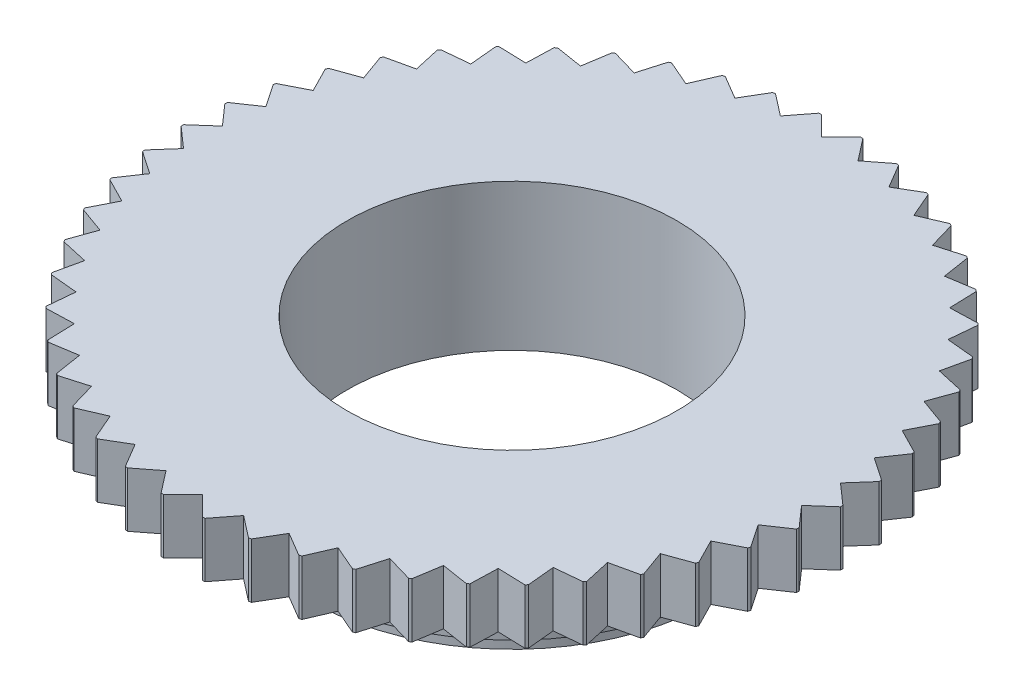
from build123d import *
from build123d.topology import SkipClean

# Parameters (mm, degrees)
SKETCH1_R           = 18
SKETCH1_R_2         = 9
BOSS_EXTRUDE1_DEPTH = 3
BOSS_EXTRUDE2_START = 5
SKETCH2_R           = 11.8
SKETCH2_R_2         = 9
BOSS_EXTRUDE2_DEPTH = 5
THREAD1_PITCH       = 1.5
SKETCH5_R           = 11.8
SKETCH5_R_2         = 11
CUT_EXTRUDE1_DEPTH  = 1
CUT_EXTRUDE3_START  = -3
CUT_EXTRUDE3_DEPTH  = 3


with BuildPart() as part:
    # Sketch1 → Boss-Extrude1 (new body)
    with BuildSketch(Plane(origin=(0, 0, 0), x_dir=(1, 0, 0), z_dir=(0, 1, 0))):
        with Locations(Location((0, 0, 0), (0, 0, 270))):
            Circle(SKETCH1_R)
        with Locations(Location((0, 0, 0), (0, 0, 270))):
            Circle(SKETCH1_R_2, mode=Mode.SUBTRACT)
    extrude(amount=BOSS_EXTRUDE1_DEPTH)

    # Sketch2 → Boss-Extrude2 (add)
    with SkipClean():  # the faces are left unmerged after this step: merging them gives an invalid solid
        with BuildSketch(Plane.XZ.offset(BOSS_EXTRUDE2_START)):
            with Locations(Location((0, 0, 0), (0, 0, 90))):
                Circle(SKETCH2_R)
            with Locations(Location((0, 0, 0), (0, 0, 270))):
                Circle(SKETCH2_R_2, mode=Mode.SUBTRACT)
        extrude(amount=-BOSS_EXTRUDE2_DEPTH)

    # Thread1: the profile of Thread Profile1 profile screwed along a right-hand helix of 1 turns, 8 arcs to a turn; built about Z, then put on its axis
    with SkipClean():  # the faces are left unmerged after this step: merging them gives an invalid solid
        thread1_z = Axis((0, 0, 0), (0, 0, 1))
        thread1_corners = [(11.7997, 0, -0.000173205), (11.7997, 0, 1.312673201), (12.611898813, 0, 0.843749998), (12.611898813, 0, 0.468749998)]
        with BuildLine(mode=Mode.PRIVATE) as thread1_profile:
            Line(thread1_corners[0], thread1_corners[1])
            Line(thread1_corners[1], thread1_corners[2])
            Line(thread1_corners[2], thread1_corners[3])
            Line(thread1_corners[3], thread1_corners[0])
        thread1_cap = Face(thread1_profile.wire())
        thread1_turn_angles = [0, 22.5, 45, 67.5, 90, 112.5, 135, 157.5, 180, 202.5, 225, 247.5, 270, 292.5, 315, 337.5, 360]
        thread1_turn_weights = [1, 0.9238795325112867, 1, 0.9238795325112867, 1, 0.9238795325112867, 1, 0.9238795325112867, 1, 0.9238795325112867, 1, 0.9238795325112867, 1, 0.9238795325112867, 1, 0.9238795325112867, 1]
        thread1_turn_rails = [Edge.make_bspline([Vector(p[0], p[1], 0).rotate(thread1_z, thread1_turn_angles[k]) / thread1_turn_weights[k] + Vector(0, 0, p[2] + THREAD1_PITCH * thread1_turn_angles[k] / 360) for k in range(17)], [0, 0, 0, 1, 1, 2, 2, 3, 3, 4, 4, 5, 5, 6, 6, 7, 7, 8, 8, 8], 2, thread1_turn_weights) for p in thread1_corners]
        thread1_turn_sides = [Face.make_surface_from_curves(thread1_turn_rails[p[0]], thread1_turn_rails[p[1]]) for p in [(0, 1), (1, 2), (2, 3), (3, 0)]]
        thread1 = Plane(origin=(0, -3.5, 0), x_dir=(1, 0, 0), z_dir=(0, 1, 0)) * Solid(Shell([*thread1_turn_sides, thread1_cap, thread1_cap.rotate(thread1_z, 360).moved(Location((0, 0, THREAD1_PITCH * 360 / 360)))]))
        add(thread1)

    # Sketch5 → Cut-Extrude1 (cut)
    with SkipClean():  # the faces are left unmerged after this step: merging them gives an invalid solid
        with BuildSketch(Plane.XZ.offset(5)):
            with Locations(Location((0, 0, 0), (0, 0, 90))):
                Circle(SKETCH5_R)
            with Locations(Location((0, 0, 0), (0, 0, 270))):
                Circle(SKETCH5_R_2, mode=Mode.SUBTRACT)
        extrude(amount=-CUT_EXTRUDE1_DEPTH, mode=Mode.SUBTRACT)

    # Sketch8 → Cut-Extrude3 (cut)
    with SkipClean():  # the faces are left unmerged after this step: merging them gives an invalid solid
        with BuildSketch(Plane(origin=(0, 3, 0), x_dir=(1, 0, 0), z_dir=(0, 1, 0)).offset(CUT_EXTRUDE3_START)):
            with BuildLine():
                Line((-1.060660172, 17.968722826), (0, 16.908062654))
                Line((0, 16.908062654), (1.060660172, 17.968722826))
                ThreePointArc((1.060660172, 17.968722826), (0, 18), (-1.060660172, 17.968722826))
            make_face()
            with BuildLine():
                Line((2.119142166, 16.77473753), (3.304374684, 17.694098111))
                ThreePointArc((3.304374684, 17.694098111), (2.255998204, 17.858064624), (1.199781585, 17.959970049))
                Line((1.199781585, 17.959970049), (2.119142166, 16.77473753))
            make_face()
            with BuildLine():
                Line((4.204864194, 16.376864774), (5.495977234, 17.140426898))
                ThreePointArc((5.495977234, 17.140426898), (4.476417969, 17.4344969), (3.44130207, 17.667977815))
                Line((3.44130207, 17.667977815), (4.204864194, 16.376864774))
            make_face()
            with BuildLine():
                Line((6.224273001, 15.720719078), (7.60090494, 16.316440914))
                ThreePointArc((7.60090494, 16.316440914), (6.626241948, 16.735976746), (5.628551165, 17.097351016))
                Line((5.628551165, 17.097351016), (6.224273001, 15.720719078))
            make_face()
            with BuildLine():
                Line((8.145521306, 14.816648251), (9.585961834, 15.23513491))
                ThreePointArc((9.585961834, 15.23513491), (8.671566134, 15.773520241), (7.727034647, 16.257088779))
                Line((7.727034647, 16.257088779), (8.145521306, 14.816648251))
            make_face()
            with BuildLine():
                Line((9.938309873, 13.678910029), (11.419842384, 13.913561727))
                ThreePointArc((11.419842384, 13.913561727), (10.580134541, 14.562305899), (9.703658175, 15.16044254))
                Line((9.703658175, 15.16044254), (9.938309873, 13.678910029))
            make_face()
            with BuildLine():
                Line((11.574365357, 12.325447225), (13.073625197, 12.372563364))
                ThreePointArc((13.073625197, 12.372563364), (12.321847907, 13.121435294), (11.527249218, 13.824707066))
                Line((11.527249218, 13.824707066), (11.574365357, 12.325447225))
            make_face()
            with BuildLine():
                Line((13.027886185, 10.777604756), (14.521229132, 10.636442286))
                ThreePointArc((14.521229132, 10.636442286), (13.86923837, 11.473631815), (13.169048655, 12.270947703))
                Line((13.169048655, 12.270947703), (13.027886185, 10.777604756))
            make_face()
            with BuildLine():
                Line((14.275949465, 9.059793021), (15.739824608, 8.732578159))
                ThreePointArc((15.739824608, 8.732578159), (15.197902659, 9.64488231), (14.603164327, 10.523668164))
                Line((14.603164327, 10.523668164), (14.275949465, 9.059793021))
            make_face()
            with BuildLine():
                Line((15.298872494, 7.199102939), (16.710193648, 6.690996058))
                ThreePointArc((16.710193648, 6.690996058), (16.286886944, 7.664027248), (15.806979375, 8.610424092))
                Line((15.806979375, 8.610424092), (15.298872494, 7.199102939))
            make_face()
            with BuildLine():
                Line((16.080523165, 5.224878702), (17.417032952, 4.543892953))
                ThreePointArc((17.417032952, 4.543892953), (17.119017293, 5.562305899), (16.761508915, 6.561388488))
                Line((16.761508915, 6.561388488), (16.080523165, 5.224878702))
            make_face()
            with BuildLine():
                Line((16.60857438, 3.168255007), (17.849195241, 2.32512994))
                ThreePointArc((17.849195241, 2.32512994), (17.681170513, 3.372863663), (17.451699447, 4.408875869))
                Line((17.451699447, 4.408875869), (16.60857438, 3.168255007))
            make_face()
            with BuildLine():
                Line((16.874698455, 1.061666038), (17.999865059, 0.06969824))
                ThreePointArc((17.999865059, 0.06969824), (17.964481112, 1.130229352), (17.866666253, 2.186832643))
                Line((17.866666253, 2.186832643), (16.874698455, 1.061666038))
            make_face()
            with BuildLine():
                Line((16.874698455, -1.061666038), (17.866666253, -2.186832643))
                ThreePointArc((17.866666253, -2.186832643), (17.964481112, -1.130229352), (17.999865059, -0.06969824))
                Line((17.999865059, -0.06969824), (16.874698455, -1.061666038))
            make_face()
            with BuildLine():
                Line((16.60857438, -3.168255007), (17.451699447, -4.408875869))
                ThreePointArc((17.451699447, -4.408875869), (17.681170513, -3.372863663), (17.849195241, -2.32512994))
                Line((17.849195241, -2.32512994), (16.60857438, -3.168255007))
            make_face()
            with BuildLine():
                Line((16.080523165, -5.224878702), (16.761508915, -6.561388488))
                ThreePointArc((16.761508915, -6.561388488), (17.119017293, -5.562305899), (17.417032952, -4.543892953))
                Line((17.417032952, -4.543892953), (16.080523165, -5.224878702))
            make_face()
            with BuildLine():
                Line((15.298872494, -7.199102939), (15.806979375, -8.610424092))
                ThreePointArc((15.806979375, -8.610424092), (16.286886944, -7.664027248), (16.710193648, -6.690996058))
                Line((16.710193648, -6.690996058), (15.298872494, -7.199102939))
            make_face()
            with BuildLine():
                Line((14.275949465, -9.059793021), (14.603164327, -10.523668164))
                ThreePointArc((14.603164327, -10.523668164), (15.197902659, -9.64488231), (15.739824608, -8.732578159))
                Line((15.739824608, -8.732578159), (14.275949465, -9.059793021))
            make_face()
            with BuildLine():
                Line((13.027886185, -10.777604756), (13.169048655, -12.270947703))
                ThreePointArc((13.169048655, -12.270947703), (13.86923837, -11.473631815), (14.521229132, -10.636442286))
                Line((14.521229132, -10.636442286), (13.027886185, -10.777604756))
            make_face()
            with BuildLine():
                Line((11.574365357, -12.325447225), (11.527249218, -13.824707066))
                ThreePointArc((11.527249218, -13.824707066), (12.321847907, -13.121435294), (13.073625197, -12.372563364))
                Line((13.073625197, -12.372563364), (11.574365357, -12.325447225))
            make_face()
            with BuildLine():
                Line((9.938309873, -13.678910029), (9.703658175, -15.16044254))
                ThreePointArc((9.703658175, -15.16044254), (10.580134541, -14.562305899), (11.419842384, -13.913561727))
                Line((11.419842384, -13.913561727), (9.938309873, -13.678910029))
            make_face()
            with BuildLine():
                Line((8.145521306, -14.816648251), (7.727034647, -16.257088779))
                ThreePointArc((7.727034647, -16.257088779), (8.671566134, -15.773520241), (9.585961834, -15.23513491))
                Line((9.585961834, -15.23513491), (8.145521306, -14.816648251))
            make_face()
            with BuildLine():
                Line((6.224273001, -15.720719078), (5.628551165, -17.097351016))
                ThreePointArc((5.628551165, -17.097351016), (6.626241948, -16.735976746), (7.60090494, -16.316440914))
                Line((7.60090494, -16.316440914), (6.224273001, -15.720719078))
            make_face()
            with BuildLine():
                Line((4.204864194, -16.376864774), (3.44130207, -17.667977815))
                ThreePointArc((3.44130207, -17.667977815), (4.476417969, -17.4344969), (5.495977234, -17.140426898))
                Line((5.495977234, -17.140426898), (4.204864194, -16.376864774))
            make_face()
            with BuildLine():
                Line((2.119142166, -16.77473753), (1.199781585, -17.959970049))
                ThreePointArc((1.199781585, -17.959970049), (2.255998204, -17.858064624), (3.304374684, -17.694098111))
                Line((3.304374684, -17.694098111), (2.119142166, -16.77473753))
            make_face()
            with BuildLine():
                Line((0, -16.908062654), (-1.060660172, -17.968722826))
                ThreePointArc((-1.060660172, -17.968722826), (0, -18), (1.060660172, -17.968722826))
                Line((1.060660172, -17.968722826), (0, -16.908062654))
            make_face()
            with BuildLine():
                Line((-2.119142166, -16.77473753), (-3.304374684, -17.694098111))
                ThreePointArc((-3.304374684, -17.694098111), (-2.255998204, -17.858064624), (-1.199781585, -17.959970049))
                Line((-1.199781585, -17.959970049), (-2.119142166, -16.77473753))
            make_face()
            with BuildLine():
                Line((-4.204864194, -16.376864774), (-5.495977234, -17.140426898))
                ThreePointArc((-5.495977234, -17.140426898), (-4.476417969, -17.4344969), (-3.44130207, -17.667977815))
                Line((-3.44130207, -17.667977815), (-4.204864194, -16.376864774))
            make_face()
            with BuildLine():
                Line((-6.224273001, -15.720719078), (-7.60090494, -16.316440914))
                ThreePointArc((-7.60090494, -16.316440914), (-6.626241948, -16.735976746), (-5.628551165, -17.097351016))
                Line((-5.628551165, -17.097351016), (-6.224273001, -15.720719078))
            make_face()
            with BuildLine():
                Line((-8.145521306, -14.816648251), (-9.585961834, -15.23513491))
                ThreePointArc((-9.585961834, -15.23513491), (-8.671566134, -15.773520241), (-7.727034647, -16.257088779))
                Line((-7.727034647, -16.257088779), (-8.145521306, -14.816648251))
            make_face()
            with BuildLine():
                Line((-9.938309873, -13.678910029), (-11.419842384, -13.913561727))
                ThreePointArc((-11.419842384, -13.913561727), (-10.580134541, -14.562305899), (-9.703658175, -15.16044254))
                Line((-9.703658175, -15.16044254), (-9.938309873, -13.678910029))
            make_face()
            with BuildLine():
                Line((-11.574365357, -12.325447225), (-13.073625197, -12.372563364))
                ThreePointArc((-13.073625197, -12.372563364), (-12.321847907, -13.121435294), (-11.527249218, -13.824707066))
                Line((-11.527249218, -13.824707066), (-11.574365357, -12.325447225))
            make_face()
            with BuildLine():
                Line((-13.027886185, -10.777604756), (-14.521229132, -10.636442286))
                ThreePointArc((-14.521229132, -10.636442286), (-13.86923837, -11.473631815), (-13.169048655, -12.270947703))
                Line((-13.169048655, -12.270947703), (-13.027886185, -10.777604756))
            make_face()
            with BuildLine():
                Line((-14.275949465, -9.059793021), (-15.739824608, -8.732578159))
                ThreePointArc((-15.739824608, -8.732578159), (-15.197902659, -9.64488231), (-14.603164327, -10.523668164))
                Line((-14.603164327, -10.523668164), (-14.275949465, -9.059793021))
            make_face()
            with BuildLine():
                Line((-15.298872494, -7.199102939), (-16.710193648, -6.690996058))
                ThreePointArc((-16.710193648, -6.690996058), (-16.286886944, -7.664027248), (-15.806979375, -8.610424092))
                Line((-15.806979375, -8.610424092), (-15.298872494, -7.199102939))
            make_face()
            with BuildLine():
                Line((-16.080523165, -5.224878702), (-17.417032952, -4.543892953))
                ThreePointArc((-17.417032952, -4.543892953), (-17.119017293, -5.562305899), (-16.761508915, -6.561388488))
                Line((-16.761508915, -6.561388488), (-16.080523165, -5.224878702))
            make_face()
            with BuildLine():
                Line((-16.60857438, -3.168255007), (-17.849195241, -2.32512994))
                ThreePointArc((-17.849195241, -2.32512994), (-17.681170513, -3.372863663), (-17.451699447, -4.408875869))
                Line((-17.451699447, -4.408875869), (-16.60857438, -3.168255007))
            make_face()
            with BuildLine():
                Line((-16.874698455, -1.061666038), (-17.999865059, -0.06969824))
                ThreePointArc((-17.999865059, -0.06969824), (-17.964481112, -1.130229352), (-17.866666253, -2.186832643))
                Line((-17.866666253, -2.186832643), (-16.874698455, -1.061666038))
            make_face()
            with BuildLine():
                Line((-16.874698455, 1.061666038), (-17.866666253, 2.186832643))
                ThreePointArc((-17.866666253, 2.186832643), (-17.964481112, 1.130229352), (-17.999865059, 0.06969824))
                Line((-17.999865059, 0.06969824), (-16.874698455, 1.061666038))
            make_face()
            with BuildLine():
                Line((-16.60857438, 3.168255007), (-17.451699447, 4.408875869))
                ThreePointArc((-17.451699447, 4.408875869), (-17.681170513, 3.372863663), (-17.849195241, 2.32512994))
                Line((-17.849195241, 2.32512994), (-16.60857438, 3.168255007))
            make_face()
            with BuildLine():
                Line((-16.080523165, 5.224878702), (-16.761508915, 6.561388488))
                ThreePointArc((-16.761508915, 6.561388488), (-17.119017293, 5.562305899), (-17.417032952, 4.543892953))
                Line((-17.417032952, 4.543892953), (-16.080523165, 5.224878702))
            make_face()
            with BuildLine():
                Line((-15.298872494, 7.199102939), (-15.806979375, 8.610424092))
                ThreePointArc((-15.806979375, 8.610424092), (-16.286886944, 7.664027248), (-16.710193648, 6.690996058))
                Line((-16.710193648, 6.690996058), (-15.298872494, 7.199102939))
            make_face()
            with BuildLine():
                Line((-14.275949465, 9.059793021), (-14.603164327, 10.523668164))
                ThreePointArc((-14.603164327, 10.523668164), (-15.197902659, 9.64488231), (-15.739824608, 8.732578159))
                Line((-15.739824608, 8.732578159), (-14.275949465, 9.059793021))
            make_face()
            with BuildLine():
                Line((-13.027886185, 10.777604756), (-13.169048655, 12.270947703))
                ThreePointArc((-13.169048655, 12.270947703), (-13.86923837, 11.473631815), (-14.521229132, 10.636442286))
                Line((-14.521229132, 10.636442286), (-13.027886185, 10.777604756))
            make_face()
            with BuildLine():
                Line((-11.574365357, 12.325447225), (-11.527249218, 13.824707066))
                ThreePointArc((-11.527249218, 13.824707066), (-12.321847907, 13.121435294), (-13.073625197, 12.372563364))
                Line((-13.073625197, 12.372563364), (-11.574365357, 12.325447225))
            make_face()
            with BuildLine():
                Line((-9.938309873, 13.678910029), (-9.703658175, 15.16044254))
                ThreePointArc((-9.703658175, 15.16044254), (-10.580134541, 14.562305899), (-11.419842384, 13.913561727))
                Line((-11.419842384, 13.913561727), (-9.938309873, 13.678910029))
            make_face()
            with BuildLine():
                Line((-8.145521306, 14.816648251), (-7.727034647, 16.257088779))
                ThreePointArc((-7.727034647, 16.257088779), (-8.671566134, 15.773520241), (-9.585961834, 15.23513491))
                Line((-9.585961834, 15.23513491), (-8.145521306, 14.816648251))
            make_face()
            with BuildLine():
                Line((-6.224273001, 15.720719078), (-5.628551165, 17.097351016))
                ThreePointArc((-5.628551165, 17.097351016), (-6.626241948, 16.735976746), (-7.60090494, 16.316440914))
                Line((-7.60090494, 16.316440914), (-6.224273001, 15.720719078))
            make_face()
            with BuildLine():
                Line((-4.204864194, 16.376864774), (-3.44130207, 17.667977815))
                ThreePointArc((-3.44130207, 17.667977815), (-4.476417969, 17.4344969), (-5.495977234, 17.140426898))
                Line((-5.495977234, 17.140426898), (-4.204864194, 16.376864774))
            make_face()
            with BuildLine():
                Line((-2.119142166, 16.77473753), (-1.199781585, 17.959970049))
                ThreePointArc((-1.199781585, 17.959970049), (-2.255998204, 17.858064624), (-3.304374684, 17.694098111))
                Line((-3.304374684, 17.694098111), (-2.119142166, 16.77473753))
            make_face()
        extrude(amount=CUT_EXTRUDE3_DEPTH, mode=Mode.SUBTRACT)


solid = part.part
